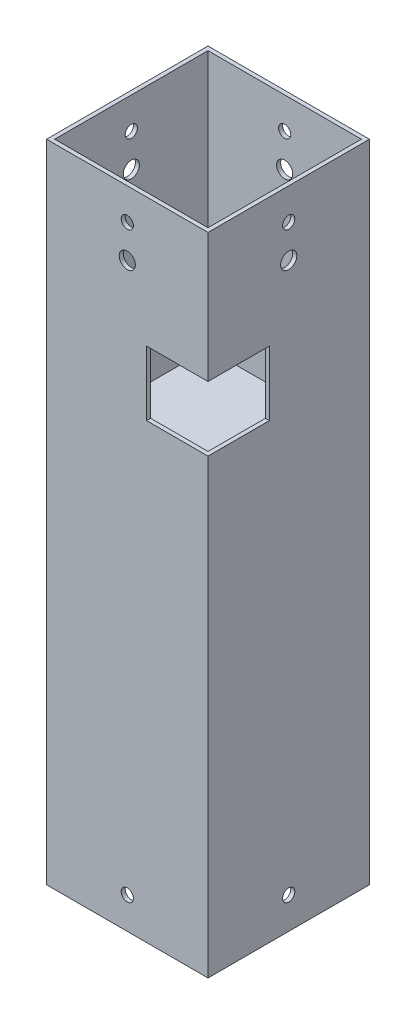
from build123d import *

# Parameters (mm, degrees)
SKETCH1_W               = 63.5
SKETCH1_H               = 63.5
SKETCH1_W_2             = 60.325
SKETCH1_H_2             = 60.325
BOSS_EXTRUDE1_DEPTH     = 254
SKETCH3_W               = 60.325
SKETCH3_H               = 60.325
BOSS_EXTRUDE3_DEPTH     = 2.54
CUT_EXTRUDE1_DEPTH      = 264.357589897
CUT_EXTRUDE1_DEPTH_BACK = 264.357589897
SKETCH4_R               = 2.3999952
SKETCH5_R               = 2.3999952
CUT_EXTRUDE2_DEPTH      = 264.735307648
CUT_EXTRUDE3_DEPTH      = 264.735307648
CUT_EXTRUDE3_DEPTH_BACK = 264.735307648
SKETCH6_R               = 2.3999952
CUT_EXTRUDE4_DEPTH      = 264.735307648
CUT_EXTRUDE4_DEPTH_BACK = 264.735307648
SKETCH7_R               = 2.3999952
CUT_EXTRUDE5_DEPTH      = 264.735307648
CUT_EXTRUDE5_DEPTH_BACK = 264.735307648
SKETCH8_R               = 3.175
CUT_EXTRUDE6_DEPTH      = 264.735307648
CUT_EXTRUDE6_DEPTH_BACK = 264.735307648
SKETCH9_R               = 3.175
SKETCH10_W              = 24.13
SKETCH10_H              = 25.4
CUT_EXTRUDE7_DEPTH      = 24.13


with BuildPart() as part:
    # Sketch1 → Boss-Extrude1 (new body)
    with BuildSketch(Plane(origin=(0, 0, 0), x_dir=(1, 0, 0), z_dir=(0, 1, 0))):
        Rectangle(SKETCH1_W, SKETCH1_H)
        Rectangle(SKETCH1_W_2, SKETCH1_H_2, mode=Mode.SUBTRACT)
    extrude(amount=BOSS_EXTRUDE1_DEPTH)

    # Sketch3 → Boss-Extrude3 (add)
    with BuildSketch(Plane(origin=(0, 152.4, 0), x_dir=(1, 0, 0), z_dir=(0, 1, 0))):
        Rectangle(SKETCH3_W, SKETCH3_H)
    extrude(amount=-BOSS_EXTRUDE3_DEPTH)

    # Sketch4 → Cut-Extrude1 (cut, two sides: drawn at the far end of the back side and taken through both)
    with BuildSketch(Plane(origin=(-30.1625, 0, 0), x_dir=(0, 0, -1), z_dir=(1, 0, 0)).offset(-CUT_EXTRUDE1_DEPTH_BACK)):
        with Locations((0, 241.587599882)):
            Circle(SKETCH4_R)
    extrude(amount=CUT_EXTRUDE1_DEPTH + CUT_EXTRUDE1_DEPTH_BACK, mode=Mode.SUBTRACT)

    # Sketch5 → Cut-Extrude2 (cut, through all)
    with BuildSketch(Plane(origin=(0, 0, -31.75), x_dir=(-1, 0, 0), z_dir=(0, 0, -1))):
        with Locations((0, 241.587599882)):
            Circle(SKETCH5_R)
    extrude(amount=-CUT_EXTRUDE2_DEPTH, mode=Mode.SUBTRACT)

    # Sketch6 → Cut-Extrude3 (cut, two sides: drawn at the far end of the back side and taken through both)
    with BuildSketch(Plane(origin=(31.75, 0, 0), x_dir=(0, 0, -1), z_dir=(1, 0, 0)).offset(-CUT_EXTRUDE3_DEPTH_BACK)):
        with Locations((0, 12.412400118)):
            Circle(SKETCH6_R)
    extrude(amount=CUT_EXTRUDE3_DEPTH + CUT_EXTRUDE3_DEPTH_BACK, mode=Mode.SUBTRACT)

    # Sketch7 → Cut-Extrude4 (cut, two sides: drawn at the far end of the back side and taken through both)
    with BuildSketch(Plane(origin=(0, 0, -31.75), x_dir=(-1, 0, 0), z_dir=(0, 0, -1)).offset(-CUT_EXTRUDE4_DEPTH_BACK)):
        with Locations((0, 12.412400118)):
            Circle(SKETCH7_R)
    extrude(amount=CUT_EXTRUDE4_DEPTH + CUT_EXTRUDE4_DEPTH_BACK, mode=Mode.SUBTRACT)

    # Sketch8 → Cut-Extrude5 (cut, two sides: drawn at the far end of the back side and taken through both)
    with BuildSketch(Plane(origin=(0, 0, -31.75), x_dir=(-1, 0, 0), z_dir=(0, 0, -1)).offset(-CUT_EXTRUDE5_DEPTH_BACK)):
        with Locations((0, 228.6)):
            Circle(SKETCH8_R)
    extrude(amount=CUT_EXTRUDE5_DEPTH + CUT_EXTRUDE5_DEPTH_BACK, mode=Mode.SUBTRACT)

    # Sketch9 → Cut-Extrude6 (cut, two sides: drawn at the far end of the back side and taken through both)
    with BuildSketch(Plane(origin=(31.75, 0, 0), x_dir=(0, 0, -1), z_dir=(1, 0, 0)).offset(-CUT_EXTRUDE6_DEPTH_BACK)):
        with Locations((0, 228.6)):
            Circle(SKETCH9_R)
    extrude(amount=CUT_EXTRUDE6_DEPTH + CUT_EXTRUDE6_DEPTH_BACK, mode=Mode.SUBTRACT)

    # Sketch10 → Cut-Extrude7 (cut)
    with BuildSketch(Plane(origin=(31.75, 0, 0), x_dir=(0, 0, -1), z_dir=(1, 0, 0))):
        with Locations((-19.685, 190.5)):
            Rectangle(SKETCH10_W, SKETCH10_H)
    extrude(amount=-CUT_EXTRUDE7_DEPTH, mode=Mode.SUBTRACT)


solid = part.part
